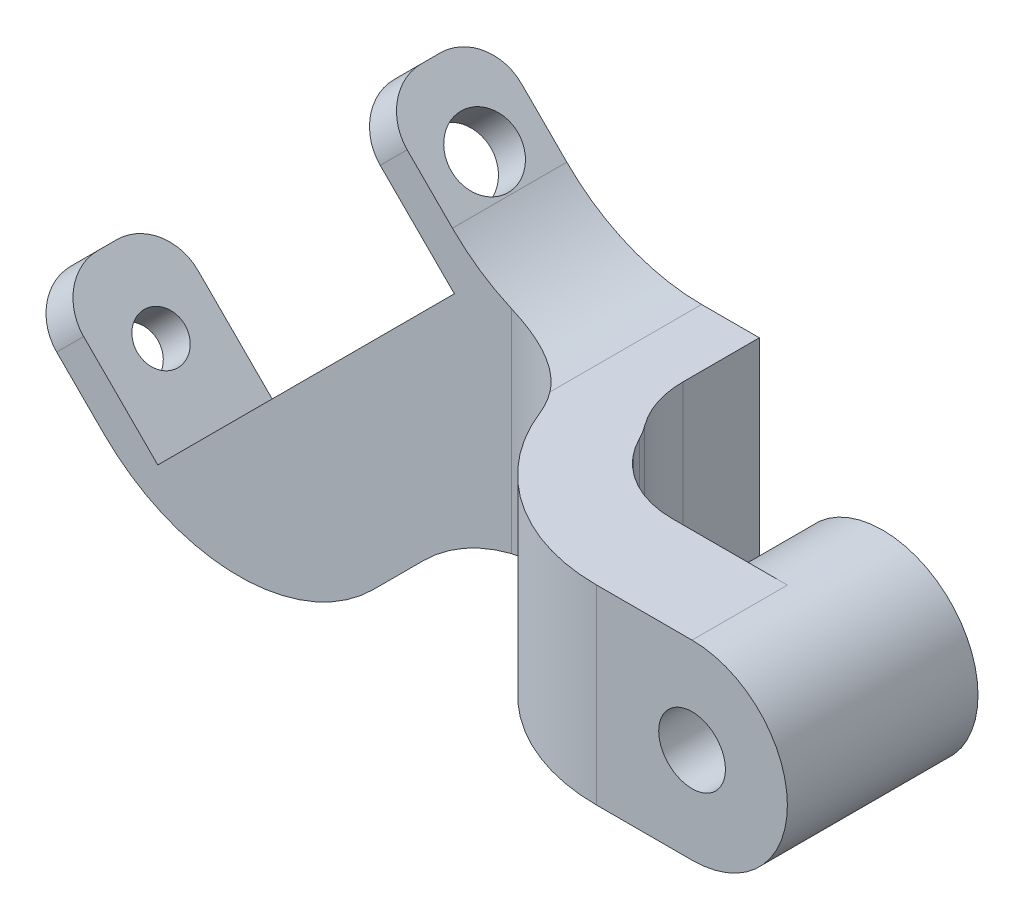
from build123d import *
from build123d.topology import SkipClean

# Parameters (mm, degrees)
ESTRUSIONE_ESTRUSIONE1_DEPTH  = 6
ESTRUSIONE_ESTRUSIONE3_START  = -11
SCHIZZO3_R                    = 5
SCHIZZO3_R_2                  = 2.65
ESTRUSIONE_ESTRUSIONE3_DEPTH  = 11
SCHIZZO5_R                    = 0.925
ESTRUSIONE_ESTRUSIONE4_DEPTH  = 20
SCHIZZO12_W                   = 8
SCHIZZO12_H                   = 6
ESTRUSIONE_ESTRUSIONE6_DEPTH  = 2
SCHIZZO13_W                   = 6
SCHIZZO13_H                   = 2
ESTRUSIONE_ESTRUSIONE7_DEPTH  = 3
RACCORDO2_R                   = 2.5
SCHIZZO14_R                   = 1.75
SCHIZZO14_R_2                 = 0.925
TAGLIO_ESTRUSIONE7_DEPTH      = 25
SCHIZZO15_W                   = 6
SCHIZZO15_H                   = 8
ESTRUSIONE_ESTRUSIONE8_DEPTH  = 24
SCHIZZO16_W                   = 6
SCHIZZO16_H                   = 2
ESTRUSIONE_ESTRUSIONE9_DEPTH  = 7.999994
SCHIZZO17_R                   = 1.25
TAGLIO_ESTRUSIONE8_DEPTH      = 25
RACCORDO3_R                   = 10
RACCORDO4_R                   = 10
RACCORDO5_R                   = 10
RACCORDO6_R                   = 2.5
SCHIZZO18_R                   = 1.75
TAGLIO_ESTRUSIONE9_DEPTH      = 39.431359843
SCHIZZO20_W                   = 20
SCHIZZO20_H                   = 19.30891557
TAGLIO_ESTRUSIONE10_DEPTH     = 39.431359843
SCHIZZO21_W                   = 5
SCHIZZO21_H                   = 10
ESTRUSIONE_ESTRUSIONE10_DEPTH = 9.5
SCHIZZO22_W                   = 5
SCHIZZO22_H                   = 10
ESTRUSIONE_ESTRUSIONE11_DEPTH = 15
RACCORDO7_R                   = 5
RACCORDO8_R                   = 10
RACCORDO9_R                   = 5
ESTRUSIONE_ESTRUSIONE13_START = 5
SCHIZZO24_R                   = 5
SCHIZZO24_R_2                 = 2.6
ESTRUSIONE_ESTRUSIONE13_DEPTH = 5
SCHIZZO26_R                   = 1.75
TAGLIO_ESTRUSIONE12_DEPTH     = 39.29124471
RACCORDO10_R                  = 5


with BuildPart() as part:
    # Schizzo1 → Estrusione-Estrusione1 (new body)
    with BuildSketch(Plane.XY):
        with BuildLine():
            Line((0, 0), (-20, 0))
            Line((-20, 0), (-10, 10))
            Line((-10, 10), (10, 10))
            ThreePointArc((10, 10), (15, 5), (10, 0))
            Line((10, 0), (0, 0))
        make_face()
    extrude(amount=ESTRUSIONE_ESTRUSIONE1_DEPTH)

    # Schizzo3 → Estrusione-Estrusione3 (add)
    with SkipClean():  # the faces are left unmerged after this step: merging them gives an invalid solid
        with BuildSketch(Plane.XY.offset(6).offset(ESTRUSIONE_ESTRUSIONE3_START)):
            with Locations(Location((10, 5, 0), (0, 0, 270))):
                Circle(SCHIZZO3_R)
            with Locations((10, 5)):
                Circle(SCHIZZO3_R_2, mode=Mode.SUBTRACT)
        extrude(amount=ESTRUSIONE_ESTRUSIONE3_DEPTH)



with BuildPart() as body_2:
    # Schizzo5 → Estrusione-Estrusione4 (new body)
    with BuildSketch(Plane(origin=(0, 0, 0), x_dir=(-0.7071067811865476, 0.7071067811865476, 0), z_dir=(0.7071067811865476, 0.7071067811865476, 0))):
        with Locations((18.142135624, 3)):
            Circle(SCHIZZO5_R)
    extrude(amount=-ESTRUSIONE_ESTRUSIONE4_DEPTH)

    # Schizzo12 → Estrusione-Estrusione6 (add)
    with BuildSketch(Plane(origin=(0, 0, 0), x_dir=(-0.7071067811865476, 0.7071067811865476, 0), z_dir=(0.7071067811865476, 0.7071067811865476, 0))):
        with Locations((18.142135624, 3)):
            Rectangle(SCHIZZO12_W, SCHIZZO12_H)
    extrude(amount=ESTRUSIONE_ESTRUSIONE6_DEPTH)


with BuildPart() as part_1:
    with SkipClean():  # the faces are left unmerged after this step: merging them gives an invalid solid
        add(part.part)

        add(body_2.part)  # Estrusione-Estrusione7 merges body 2
        # Schizzo13 → Estrusione-Estrusione7 (add)
        with BuildSketch(Plane(origin=(-10, 10, 0), x_dir=(0, 0, -1), z_dir=(0.7071067811865477, -0.7071067811865475, 0))):
            with Locations((-3, 1)):
                Rectangle(SCHIZZO13_W, SCHIZZO13_H)
        extrude(amount=ESTRUSIONE_ESTRUSIONE7_DEPTH)

    # Raccordo2
    raccordo2_edges = [part_1.edges().sort_by_distance(p)[0] for p in [
        (-14.949747468, 16.363961031, 0),
        (-14.949747468, 16.363961031, 6),
    ]]
    fillet(raccordo2_edges, radius=RACCORDO2_R)

    # Schizzo14 → Taglio-Estrusione7 (cut)
    # profile 1 of 2: a face of its own
    with SkipClean():  # the faces are left unmerged after this step: merging them gives an invalid solid
        with BuildSketch(Plane(origin=(1.414213562, 1.414213562, 0), x_dir=(0, 0, -1), z_dir=(0.7071067811865476, 0.7071067811865476, 0))):
            with Locations(Location((-3, 18.142135624, 0), (0, 0, 90))):
                Circle(SCHIZZO14_R)
            with Locations((-3, 18.142135624)):
                Circle(SCHIZZO14_R_2, mode=Mode.SUBTRACT)
        # profile 2 of 2: a face of its own
        with BuildSketch(Plane(origin=(1.414213562, 1.414213562, 0), x_dir=(0, 0, -1), z_dir=(0.7071067811865476, 0.7071067811865476, 0))):
            with Locations((-3, 18.142135624)):
                Circle(SCHIZZO14_R_2)
        extrude(amount=-TAGLIO_ESTRUSIONE7_DEPTH, mode=Mode.SUBTRACT)

    # Schizzo15 → Estrusione-Estrusione8 (add)
    with SkipClean():  # the faces are left unmerged after this step: merging them gives an invalid solid
        with BuildSketch(Plane(origin=(0, 0, 0), x_dir=(0, 0, 1), z_dir=(-0.7071067811865477, -0.7071067811865475, 0))):
            with Locations((3, 10.142135624)):
                Rectangle(SCHIZZO15_W, SCHIZZO15_H)
        extrude(amount=ESTRUSIONE_ESTRUSIONE8_DEPTH)

    # Schizzo16 → Estrusione-Estrusione9 (add)
    with SkipClean():  # the faces are left unmerged after this step: merging them gives an invalid solid
        with BuildSketch(Plane(origin=(-10, 10, 0), x_dir=(0, 0, 1), z_dir=(-0.7071067811865477, 0.7071067811865475, 0))):
            with Locations((3, -23)):
                Rectangle(SCHIZZO16_W, SCHIZZO16_H)
        extrude(amount=ESTRUSIONE_ESTRUSIONE9_DEPTH)

    # Schizzo17 → Taglio-Estrusione8 (cut)
    with SkipClean():  # the faces are left unmerged after this step: merging them gives an invalid solid
        with BuildSketch(Plane(origin=(-16.970562748, -16.970562748, 0), x_dir=(0, 0, 1), z_dir=(-0.7071067811865477, -0.7071067811865474, 0))):
            with Locations(Location((3, 18.142135624, 0), (0, 0, 270))):
                Circle(SCHIZZO17_R)
        extrude(amount=-TAGLIO_ESTRUSIONE8_DEPTH, mode=Mode.SUBTRACT)

    # Raccordo3
    # the kernel refuses this fillet: 10 mm, written as the material it takes off along each edge
    with BuildSketch(Plane(origin=(-21.313708499, -12.627416998, -25), x_dir=(0.7071067811865475, 0.7071067811865475, 0), z_dir=(0, 0, 1))) as raccordo3_piece_1:
        with BuildLine():
            CenterArc((RACCORDO3_R, RACCORDO3_R), RACCORDO3_R, 180, 90)
            Line((0, RACCORDO3_R), (0, 0))
            Line((0, 0), (RACCORDO3_R, 0))
        make_face()
    extrude(amount=56, mode=Mode.SUBTRACT)

    # Raccordo4
    raccordo4_edges = [part_1.edges().sort_by_distance(p)[0] for p in [
        (-8.686291501, 0, 3),
    ]]
    fillet(raccordo4_edges, radius=RACCORDO4_R)

    # Raccordo5
    raccordo5_edges = [part_1.edges().sort_by_distance(p)[0] for p in [
        (-7.171572875, 10, 3),
    ]]
    fillet(raccordo5_edges, radius=RACCORDO5_R)

    # Raccordo6
    raccordo6_edges = [part_1.edges().sort_by_distance(p)[0] for p in [
        (-31.920305974, -0.60660596, 6),
        (-31.920305974, -0.60660596, 0),
    ]]
    fillet(raccordo6_edges, radius=RACCORDO6_R)

    # Schizzo18 → Taglio-Estrusione9 (cut, through all)
    with BuildSketch(Plane.XY.offset(6)):
        with Locations((10, 5)):
            Circle(SCHIZZO18_R)
    extrude(amount=-TAGLIO_ESTRUSIONE9_DEPTH, mode=Mode.SUBTRACT)

    # Schizzo20 → Taglio-Estrusione10 (cut, through all)
    with BuildSketch(Plane(origin=(0, 0, -5), x_dir=(-1, 0, 0), z_dir=(0, 0, -1))):
        with Locations((-10, 5)):
            Rectangle(SCHIZZO20_W, SCHIZZO20_H)
    extrude(amount=-TAGLIO_ESTRUSIONE10_DEPTH, mode=Mode.SUBTRACT)

    # Schizzo21 → Estrusione-Estrusione10 (add)
    with BuildSketch(Plane.XY.offset(6)):
        with Locations((-0.529437252, 5)):
            Rectangle(SCHIZZO21_W, SCHIZZO21_H)
    extrude(amount=ESTRUSIONE_ESTRUSIONE10_DEPTH)

    # Schizzo22 → Estrusione-Estrusione11 (add)
    with BuildSketch(Plane(origin=(1.970562748, 0, 0), x_dir=(0, 0, -1), z_dir=(1, 0, 0))):
        with Locations((-13, 5)):
            Rectangle(SCHIZZO22_W, SCHIZZO22_H)
    extrude(amount=ESTRUSIONE_ESTRUSIONE11_DEPTH)

    # Raccordo7
    # the kernel refuses this fillet: 5 mm, written as the material it takes off along each edge
    with BuildSketch(Plane(origin=(1.970562748, 19.944379675, 6), x_dir=(-1, 0, 0), z_dir=(0, -1, 0))) as raccordo7_piece_1:
        with BuildLine():
            CenterArc((5, -3.97775187), RACCORDO7_R, 127.292729202, 52.707270798)
            Line((0, -3.97775187), (-0.1, -3.97775187))
            Line((-0.1, -3.97775187), (-0.1, 0))
            Line((-0.1, 0), (0, 0.1))
            ThreePointArc((0, 0.1), (0.985281374, 0.1), (1.909974003, 0.079555037))
            Line((1.909974003, 0.079555037), (1.970562748, 0))
        make_face()
    extrude(amount=29.88875935, mode=Mode.SUBTRACT)
    with BuildSketch(Plane(origin=(16.970562748, 0, -2), x_dir=(0, 1, 0), z_dir=(0, 0, 1))) as raccordo7_piece_2:
        with BuildLine():
            CenterArc((RACCORDO7_R, RACCORDO7_R), RACCORDO7_R, 180, 90)
            Line((0, RACCORDO7_R), (-RACCORDO7_R * 0.02, RACCORDO7_R))
            Line((-RACCORDO7_R * 0.02, RACCORDO7_R), (-RACCORDO7_R * 0.02, -RACCORDO7_R * 0.02))
            Line((-RACCORDO7_R * 0.02, -RACCORDO7_R * 0.02), (RACCORDO7_R, -RACCORDO7_R * 0.02))
            Line((RACCORDO7_R, -RACCORDO7_R * 0.02), (RACCORDO7_R, 0))
        make_face()
    extrude(amount=30, mode=Mode.SUBTRACT)
    with BuildSketch(Plane(origin=(16.970562748, 10, 28), x_dir=(-1, 0, 0), z_dir=(0, 0, -1))) as raccordo7_piece_3:
        with BuildLine():
            CenterArc((RACCORDO7_R, -RACCORDO7_R), RACCORDO7_R, 90, 90)
            Line((0, -RACCORDO7_R), (-RACCORDO7_R * 0.02, -RACCORDO7_R))
            Line((-RACCORDO7_R * 0.02, -RACCORDO7_R), (-RACCORDO7_R * 0.02, RACCORDO7_R * 0.02))
            Line((-RACCORDO7_R * 0.02, RACCORDO7_R * 0.02), (RACCORDO7_R, RACCORDO7_R * 0.02))
            Line((RACCORDO7_R, RACCORDO7_R * 0.02), (RACCORDO7_R, 0))
        make_face()
    extrude(amount=30, mode=Mode.SUBTRACT)

    # Raccordo8
    # the kernel refuses this fillet: 10 mm, written as the material it takes off along each edge
    with BuildSketch(Plane(origin=(-3.029437252, -24.968730444, 15.5), x_dir=(1, 0, 0), z_dir=(0, 1, 0))) as raccordo8_piece_1:
        with BuildLine():
            CenterArc((9.987492178, 10), RACCORDO8_R, 182.865983983, 87.134016017)
            Line((0, 9.5), (-0.199749844, 9.49))
            ThreePointArc((-0.199749844, 9.49), (-0.2, 4.75), (-0.2, 0))
            Line((-0.2, 0), (0, -0.2))
            Line((0, -0.2), (9.987492178, -0.2))
            Line((9.987492178, -0.2), (9.987492178, 0))
        make_face()
    extrude(amount=59.937460889, mode=Mode.SUBTRACT)

    # Raccordo9
    raccordo9_edges = [part_1.edges().sort_by_distance(p)[0] for p in [
        (-3.029437252, 5, 6),
    ]]
    fillet(raccordo9_edges, radius=RACCORDO9_R)

    # Schizzo24 → Estrusione-Estrusione13 (add)
    with BuildSketch(Plane(origin=(0, 0, 10.5), x_dir=(-1, 0, 0), z_dir=(0, 0, -1)).offset(ESTRUSIONE_ESTRUSIONE13_START)):
        with Locations(Location((-11.970562748, 5, 0), (0, 0, 180))):
            Circle(SCHIZZO24_R)
        with Locations((-11.970562748, 5)):
            Circle(SCHIZZO24_R_2, mode=Mode.SUBTRACT)
    extrude(amount=-ESTRUSIONE_ESTRUSIONE13_DEPTH)

    # Schizzo26 → Taglio-Estrusione12 (cut, through all)
    with BuildSketch(Plane(origin=(0, 0, 10.5), x_dir=(-1, 0, 0), z_dir=(0, 0, -1))):
        with Locations((-11.970562748, 5)):
            Circle(SCHIZZO26_R)
    extrude(amount=-TAGLIO_ESTRUSIONE12_DEPTH, mode=Mode.SUBTRACT)

    # Raccordo10
    raccordo10_edges = [part_1.edges().sort_by_distance(p)[0] for p in [
        (0, 5, 6),
        (1.970562748, 5, 10.5),
    ]]
    fillet(raccordo10_edges, radius=RACCORDO10_R)


solid = part_1.part
